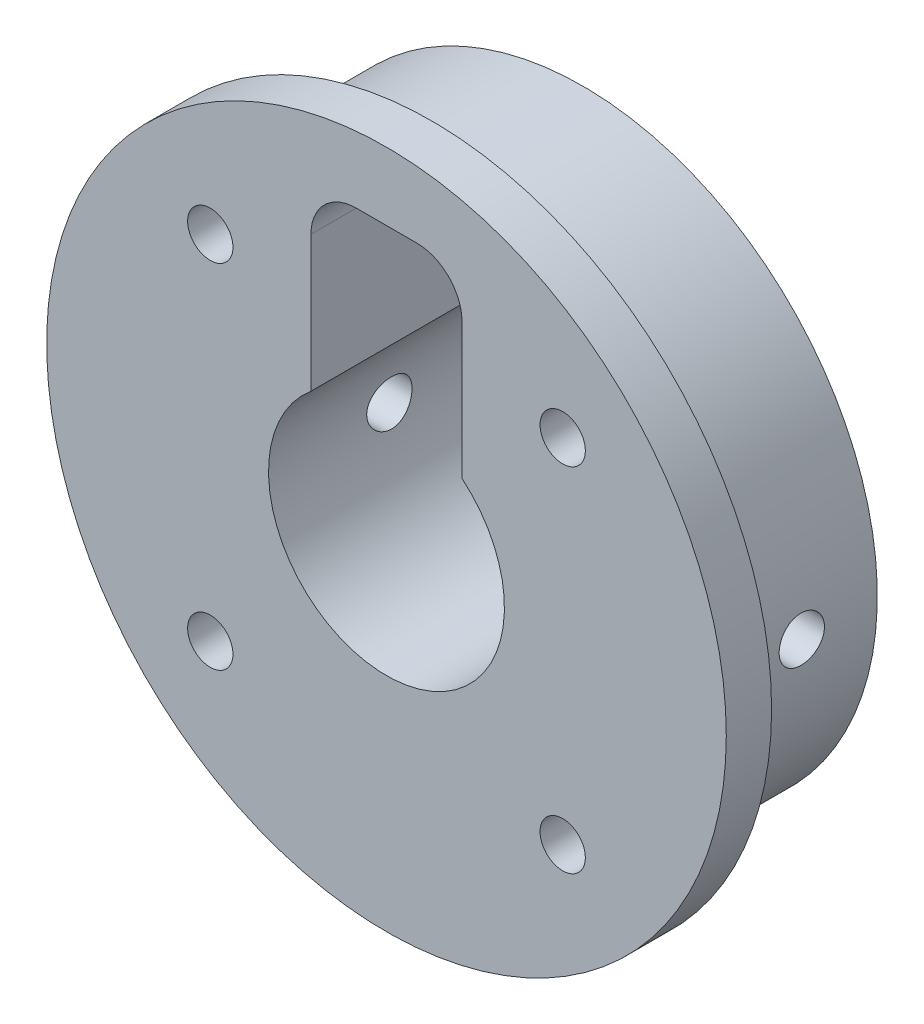
from build123d import *

# Parameters (mm, degrees)
SKETCH1_R               = 22.5
BOSS_EXTRUDE1_DEPTH     = 3
SKETCH2_R               = 19.5
BOSS_EXTRUDE2_DEPTH     = 10
CUT_EXTRUDE1_REACH      = 776.345
SKETCH3_R               = 1.5
CUT_EXTRUDE2_DEPTH      = 60.505474974
CUT_EXTRUDE2_DEPTH_BACK = 60.505474974
SKETCH4_R               = 1.5


with BuildPart() as part:
    # Sketch1 → Boss-Extrude1 (new body)
    with BuildSketch(Plane.XY):
        with Locations((750, 29.313623227)):
            Circle(SKETCH1_R)
    extrude(amount=BOSS_EXTRUDE1_DEPTH)

    # Sketch2 → Boss-Extrude2 (add)
    with BuildSketch(Plane(origin=(0, 0, 0), x_dir=(-1, 0, 0), z_dir=(0, 0, -1))):
        with Locations((-750, 29.313623227)):
            Circle(SKETCH2_R)
    extrude(amount=BOSS_EXTRUDE2_DEPTH)

    # Sketch3 → Cut-Extrude1 (cut, up to next)
    with BuildSketch(Plane.XY.offset(3), mode=Mode.PRIVATE) as cut_extrude1_sk1:
        with Locations((761.66726189, 17.646361337)):
            Circle(SKETCH3_R)
    cut_extrude1_tool1 = extrude(cut_extrude1_sk1.sketch, amount=-CUT_EXTRUDE1_REACH, mode=Mode.PRIVATE) & part.part
    # Sketch3 → Cut-Extrude1 (cut, up to next)
    with BuildSketch(Plane.XY.offset(3), mode=Mode.PRIVATE) as cut_extrude1_sk2:
        with Locations((738.33273811, 17.646361337)):
            Circle(SKETCH3_R)
    cut_extrude1_tool2 = extrude(cut_extrude1_sk2.sketch, amount=-CUT_EXTRUDE1_REACH, mode=Mode.PRIVATE) & part.part
    # Sketch3 → Cut-Extrude1 (cut, up to next)
    with BuildSketch(Plane.XY.offset(3), mode=Mode.PRIVATE) as cut_extrude1_sk3:
        with Locations((738.33273811, 40.980885116)):
            Circle(SKETCH3_R)
    cut_extrude1_tool3 = extrude(cut_extrude1_sk3.sketch, amount=-CUT_EXTRUDE1_REACH, mode=Mode.PRIVATE) & part.part
    # Sketch3 → Cut-Extrude1 (cut, up to next)
    with BuildSketch(Plane.XY.offset(3), mode=Mode.PRIVATE) as cut_extrude1_sk4:
        with Locations((761.66726189, 40.980885116)):
            Circle(SKETCH3_R)
    cut_extrude1_tool4 = extrude(cut_extrude1_sk4.sketch, amount=-CUT_EXTRUDE1_REACH, mode=Mode.PRIVATE) & part.part
    # Sketch3 → Cut-Extrude1 (cut, up to next)
    with BuildSketch(Plane.XY.offset(3), mode=Mode.PRIVATE) as cut_extrude1_sk5:
        with BuildLine():
            Line((748, 47.313623227), (752, 47.313623227))
            ThreePointArc((752, 47.313623227), (754.121320344, 46.43494357), (755, 44.313623227))
            Line((755, 44.313623227), (755, 35.313623227))
            ThreePointArc((755, 35.313623227), (750, 21.503373551), (745, 35.313623227))
            Line((745, 35.313623227), (745, 44.313623227))
            ThreePointArc((745, 44.313623227), (745.878679656, 46.43494357), (748, 47.313623227))
        make_face()
    cut_extrude1_tool5 = extrude(cut_extrude1_sk5.sketch, amount=-CUT_EXTRUDE1_REACH, mode=Mode.PRIVATE) & part.part
    add(cut_extrude1_tool1.solids().sort_by_distance((761.667262, 17.646361, 3))[0], mode=Mode.SUBTRACT)
    add(cut_extrude1_tool2.solids().sort_by_distance((738.332738, 17.646361, 3))[0], mode=Mode.SUBTRACT)
    add(cut_extrude1_tool3.solids().sort_by_distance((738.332738, 40.980885, 3))[0], mode=Mode.SUBTRACT)
    add(cut_extrude1_tool4.solids().sort_by_distance((761.667262, 40.980885, 3))[0], mode=Mode.SUBTRACT)
    add(cut_extrude1_tool5.solids().sort_by_distance((750, 33.679719, 3))[0], mode=Mode.SUBTRACT)

    # Sketch4 → Cut-Extrude2 (cut, two sides: drawn at the far end of the back side and taken through both)
    with BuildSketch(Plane(origin=(745, 0, 0), x_dir=(0, 0, -1), z_dir=(1, 0, 0)).offset(-CUT_EXTRUDE2_DEPTH_BACK)):
        with Locations((5, 29.313623227)):
            Circle(SKETCH4_R)
    extrude(amount=CUT_EXTRUDE2_DEPTH + CUT_EXTRUDE2_DEPTH_BACK, mode=Mode.SUBTRACT)


solid = part.part
